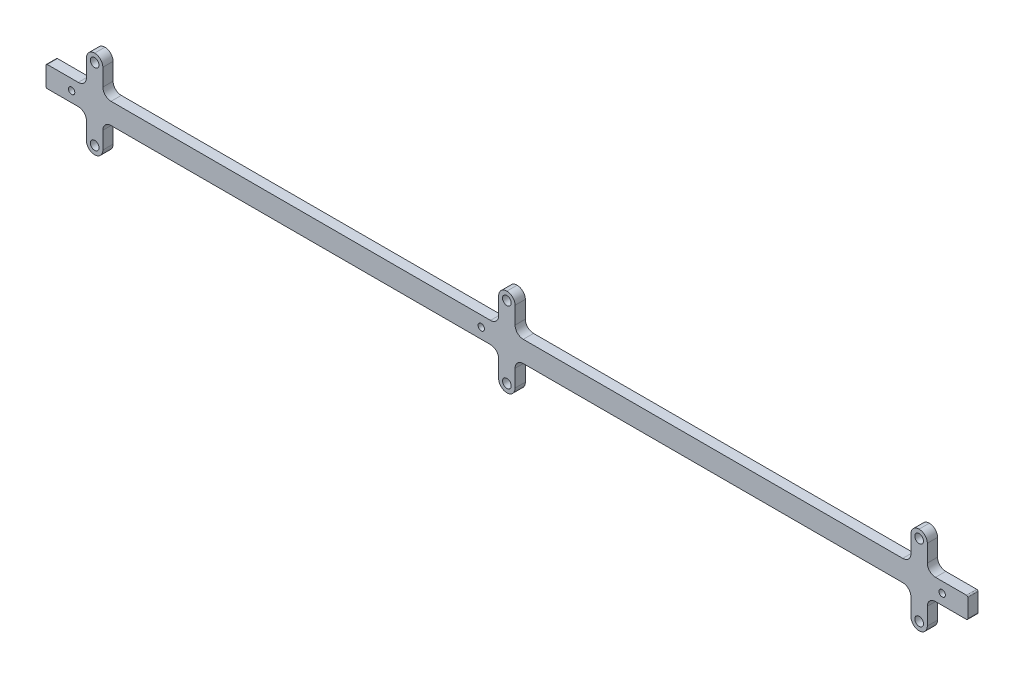
from build123d import *

# Parameters (mm, degrees)
BRIDA_BASE1_DEPTH     = 4
CROQUIS6_R            = 1.2
CORTAR_EXTRUIR1_DEPTH = 361.432850889
TALADRO_ROSCADO_M3_D  = 2.5
CROQUIS11_R           = 1.7
CORTAR_EXTRUIR2_DEPTH = 361.432850889
REDONDEO1_START       = -5
REDONDEO1_DEPTH       = 6
REDONDEO1_START_2     = -4
REDONDEO1_2_DEPTH     = 4
REDONDEO2_R           = 0.5


with BuildPart() as part:
    # Brida base1: sheet metal written as solids
    # Croquis1 → Brida base1 (new body)
    with BuildSketch(Plane.XY):
        Polygon((0, -4.1), (0, 4.1), (8, 4.1), (15.8, 4.1), (15.8, 17.2), (22.2, 17.2), (22.2, 4.1), (176.8, 4.1), (176.8, 17.2), (183.2, 17.2), (183.2, 4.1), (337.8, 4.1), (337.8, 17.2), (344.2, 17.2), (344.2, 4.1), (352, 4.1), (360, 4.1), (360, -4.1), (352, -4.1), (344.2, -4.1), (344.2, -17.2), (337.8, -17.2), (337.8, -4.1), (183.2, -4.1), (183.2, -17.2), (176.8, -17.2), (176.8, -4.1), (22.2, -4.1), (22.2, -17.2), (15.8, -17.2), (15.8, -4.1), (8, -4.1), align=None)
    extrude(amount=-BRIDA_BASE1_DEPTH)

    # Croquis6 → Cortar-Extruir1 (cut, through all)
    with BuildSketch(Plane.XY):
        with Locations((10, 0)):
            Circle(CROQUIS6_R)
        with Locations((350, 0)):
            Circle(CROQUIS6_R)
        with Locations((170, 0)):
            Circle(CROQUIS6_R)
    extrude(amount=-CORTAR_EXTRUIR1_DEPTH, mode=Mode.SUBTRACT)

    # Taladro roscado M3 (through all)
    with Locations(Plane.XY):
        with Locations((10, 0), (170, 0), (350, 0)):
            Hole(TALADRO_ROSCADO_M3_D / 2)

    # Croquis11 → Cortar-Extruir2 (cut, through all)
    with BuildSketch(Plane.XY):
        with Locations((19, 14)):
            Circle(CROQUIS11_R)
        with Locations((180, 14)):
            Circle(CROQUIS11_R)
        with Locations((341, 14)):
            Circle(CROQUIS11_R)
        with Locations(Location((341, -14, 0), (0, 0, 180))):
            Circle(CROQUIS11_R)
        with Locations(Location((180, -14, 0), (0, 0, 180))):
            Circle(CROQUIS11_R)
        with Locations(Location((19, -14, 0), (0, 0, 180))):
            Circle(CROQUIS11_R)
    extrude(amount=-CORTAR_EXTRUIR2_DEPTH, mode=Mode.SUBTRACT)

    # Redondeo1: read off the stored shape, not the designer's step
    # Redondeo1 outline → Redondeo1 (cut)
    with BuildSketch(Plane.XY.offset(REDONDEO1_START)):
        with BuildLine():
            ThreePointArc((15.8, 14), (16.7372583, 16.2627417), (19, 17.2))
            Line((19, 17.2), (15.8, 17.2))
            Line((15.8, 17.2), (15.8, 14))
        make_face()
        with BuildLine():
            ThreePointArc((19, 17.2), (21.2627417, 16.2627417), (22.2, 14))
            Line((22.2, 14), (22.2, 17.2))
            Line((22.2, 17.2), (19, 17.2))
        make_face()
        with BuildLine():
            ThreePointArc((176.8, 14), (177.7372583, 16.2627417), (180, 17.2))
            Line((180, 17.2), (176.8, 17.2))
            Line((176.8, 17.2), (176.8, 14))
        make_face()
        with BuildLine():
            ThreePointArc((180, 17.2), (182.2627417, 16.2627417), (183.2, 14))
            Line((183.2, 14), (183.2, 17.2))
            Line((183.2, 17.2), (180, 17.2))
        make_face()
        with BuildLine():
            ThreePointArc((337.8, 14), (338.7372583, 16.2627417), (341, 17.2))
            Line((341, 17.2), (337.8, 17.2))
            Line((337.8, 17.2), (337.8, 14))
        make_face()
        with BuildLine():
            ThreePointArc((341, 17.2), (343.2627417, 16.2627417), (344.2, 14))
            Line((344.2, 14), (344.2, 17.2))
            Line((344.2, 17.2), (341, 17.2))
        make_face()
        with BuildLine():
            ThreePointArc((344.2, -14), (343.2627417, -16.2627417), (341, -17.2))
            Line((341, -17.2), (344.2, -17.2))
            Line((344.2, -17.2), (344.2, -14))
        make_face()
        with BuildLine():
            ThreePointArc((341, -17.2), (338.7372583, -16.2627417), (337.8, -14))
            Line((337.8, -14), (337.8, -17.2))
            Line((337.8, -17.2), (341, -17.2))
        make_face()
        with BuildLine():
            ThreePointArc((183.2, -14), (182.2627417, -16.2627417), (180, -17.2))
            Line((180, -17.2), (183.2, -17.2))
            Line((183.2, -17.2), (183.2, -14))
        make_face()
        with BuildLine():
            ThreePointArc((180, -17.2), (177.7372583, -16.2627417), (176.8, -14))
            Line((176.8, -14), (176.8, -17.2))
            Line((176.8, -17.2), (180, -17.2))
        make_face()
        with BuildLine():
            ThreePointArc((22.2, -14), (21.2627417, -16.2627417), (19, -17.2))
            Line((19, -17.2), (22.2, -17.2))
            Line((22.2, -17.2), (22.2, -14))
        make_face()
        with BuildLine():
            ThreePointArc((19, -17.2), (16.7372583, -16.2627417), (15.8, -14))
            Line((15.8, -14), (15.8, -17.2))
            Line((15.8, -17.2), (19, -17.2))
        make_face()
    extrude(amount=REDONDEO1_DEPTH, mode=Mode.SUBTRACT)

    # Redondeo1 2 outline → Redondeo1 2 (add)
    with BuildSketch(Plane.XY.offset(REDONDEO1_START_2)):
        with BuildLine():
            Line((344.2, 4.1), (347.4, 4.1))
            ThreePointArc((347.4, 4.1), (345.1372583, 5.0372583), (344.2, 7.3))
            Line((344.2, 7.3), (344.2, 4.1))
        make_face()
        with BuildLine():
            Line((15.8, 4.1), (15.8, 7.3))
            ThreePointArc((15.8, 7.3), (14.8627417, 5.0372583), (12.6, 4.1))
            Line((12.6, 4.1), (15.8, 4.1))
        make_face()
        with BuildLine():
            Line((22.2, 4.1), (25.4, 4.1))
            ThreePointArc((25.4, 4.1), (23.1372583, 5.0372583), (22.2, 7.3))
            Line((22.2, 7.3), (22.2, 4.1))
        make_face()
        with BuildLine():
            Line((176.8, 4.1), (176.8, 7.3))
            ThreePointArc((176.8, 7.3), (175.8627417, 5.0372583), (173.6, 4.1))
            Line((173.6, 4.1), (176.8, 4.1))
        make_face()
        with BuildLine():
            Line((183.2, 4.1), (186.4, 4.1))
            ThreePointArc((186.4, 4.1), (184.1372583, 5.0372583), (183.2, 7.3))
            Line((183.2, 7.3), (183.2, 4.1))
        make_face()
        with BuildLine():
            Line((337.8, 4.1), (337.8, 7.3))
            ThreePointArc((337.8, 7.3), (336.8627417, 5.0372583), (334.6, 4.1))
            Line((334.6, 4.1), (337.8, 4.1))
        make_face()
        with BuildLine():
            Line((15.8, -4.1), (12.6, -4.1))
            ThreePointArc((12.6, -4.1), (14.8627417, -5.0372583), (15.8, -7.3))
            Line((15.8, -7.3), (15.8, -4.1))
        make_face()
        with BuildLine():
            Line((344.2, -4.1), (344.2, -7.3))
            ThreePointArc((344.2, -7.3), (345.1372583, -5.0372583), (347.4, -4.1))
            Line((347.4, -4.1), (344.2, -4.1))
        make_face()
        with BuildLine():
            Line((337.8, -4.1), (334.6, -4.1))
            ThreePointArc((334.6, -4.1), (336.8627417, -5.0372583), (337.8, -7.3))
            Line((337.8, -7.3), (337.8, -4.1))
        make_face()
        with BuildLine():
            Line((183.2, -4.1), (183.2, -7.3))
            ThreePointArc((183.2, -7.3), (184.1372583, -5.0372583), (186.4, -4.1))
            Line((186.4, -4.1), (183.2, -4.1))
        make_face()
        with BuildLine():
            Line((176.8, -4.1), (173.6, -4.1))
            ThreePointArc((173.6, -4.1), (175.8627417, -5.0372583), (176.8, -7.3))
            Line((176.8, -7.3), (176.8, -4.1))
        make_face()
        with BuildLine():
            Line((22.2, -4.1), (22.2, -7.3))
            ThreePointArc((22.2, -7.3), (23.1372583, -5.0372583), (25.4, -4.1))
            Line((25.4, -4.1), (22.2, -4.1))
        make_face()
    extrude(amount=REDONDEO1_2_DEPTH)

    # Redondeo2
    redondeo2_edges = [part.edges().sort_by_distance(p)[0] for p in [
        (0, -4.1, -2),
        (0, 4.1, -2),
        (360, 4.1, -2),
        (360, -4.1, -2),
    ]]
    fillet(redondeo2_edges, radius=REDONDEO2_R)


solid = part.part
